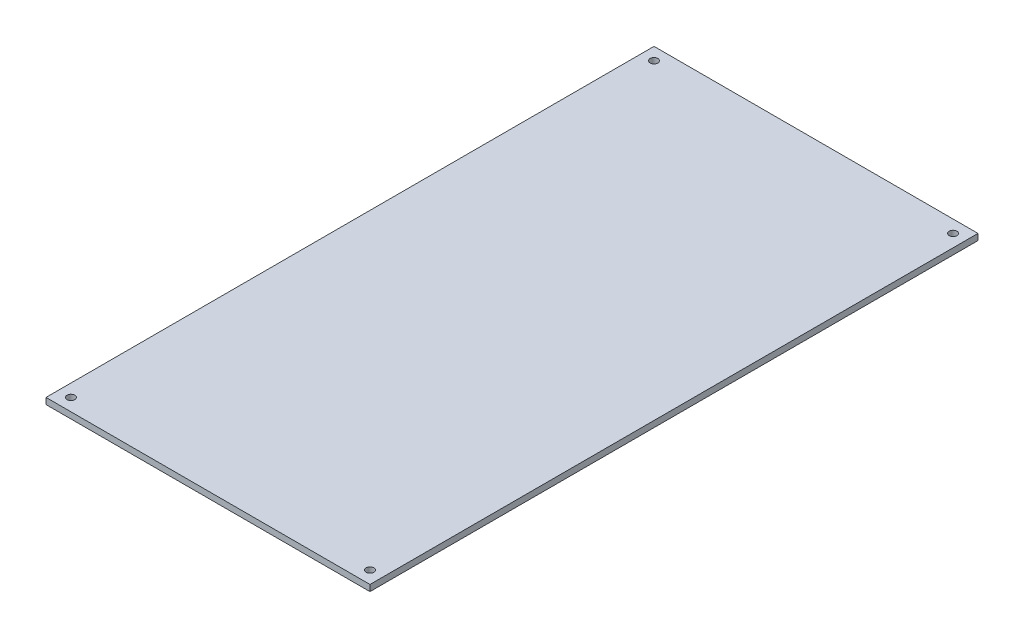
from build123d import *

# Parameters (mm, degrees)
SKETCH1_W           = 330.2
SKETCH1_H           = 619.7
SKETCH1_R           = 3.96875
BOSS_EXTRUDE1_DEPTH = 6.35


with BuildPart() as part:
    # Sketch1 → Boss-Extrude1 (new body)
    with BuildSketch(Plane(origin=(0, -91.8972, 0), x_dir=(1, 0, 0), z_dir=(0, 1, 0))):
        with Locations((-634.099999918, 316.29525)):
            Rectangle(SKETCH1_W, SKETCH1_H)
        with Locations((-786.499999918, 19.14525)):
            Circle(SKETCH1_R, mode=Mode.SUBTRACT)
        with Locations((-481.699999918, 19.14525)):
            Circle(SKETCH1_R, mode=Mode.SUBTRACT)
        with Locations((-786.499999918, 613.44525)):
            Circle(SKETCH1_R, mode=Mode.SUBTRACT)
        with Locations((-481.699999918, 613.44525)):
            Circle(SKETCH1_R, mode=Mode.SUBTRACT)
    extrude(amount=BOSS_EXTRUDE1_DEPTH)


solid = part.part
